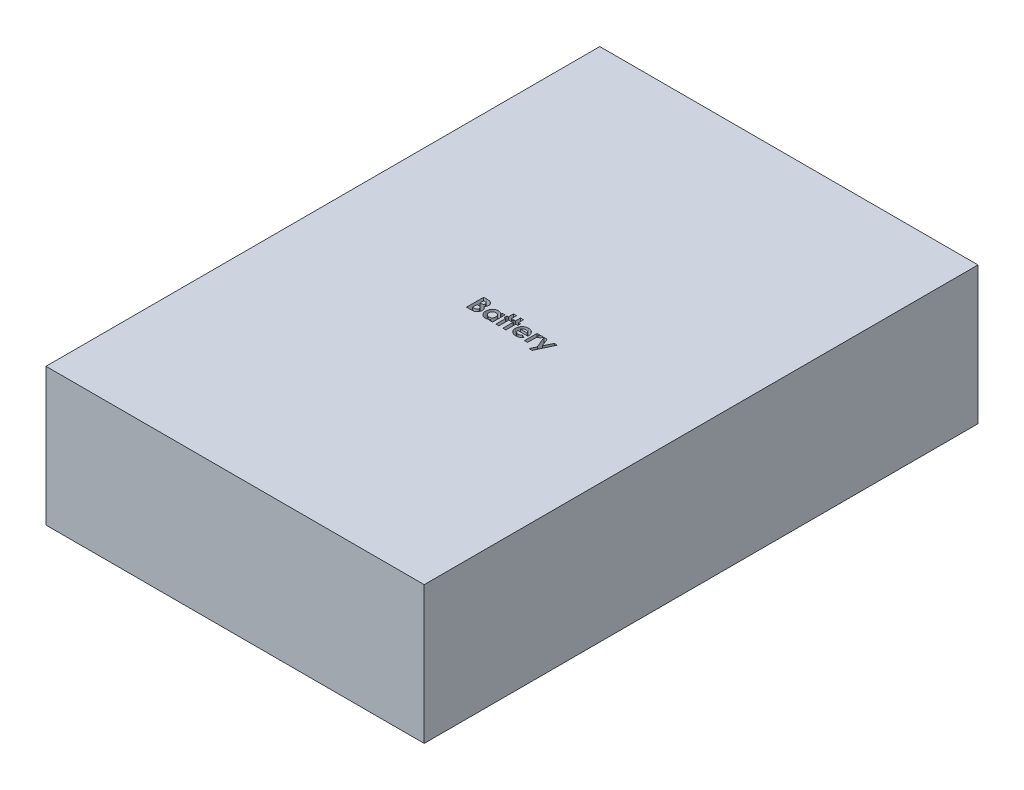
from build123d import *

# Parameters (mm, degrees)
SKETCH1_W           = 279.4
SKETCH1_H           = 409.1
BOSS_EXTRUDE1_DEPTH = 101.6
CUT_EXTRUDE1_DEPTH  = 101.6


with BuildPart() as part:
    # Sketch1 → Boss-Extrude1 (new body)
    with BuildSketch(Plane(origin=(0, 0, 0), x_dir=(1, 0, 0), z_dir=(0, 1, 0))):
        with Locations((139.7, 204.55)):
            Rectangle(SKETCH1_W, SKETCH1_H)
    extrude(amount=BOSS_EXTRUDE1_DEPTH)

    # Sketch2 → Cut-Extrude1 (cut)
    # profile 1 of 7: a face of its own
    with BuildSketch(Plane(origin=(0, 101.6, 0), x_dir=(1, 0, 0), z_dir=(0, 1, 0))):
        with BuildLine():
            Line((117.496663444, 193.133578888), (117.496663444, 205.833578888))
            Line((117.496663444, 205.833578888), (119.531919854, 205.833578888))
            add(Edge.make_bspline(
                [(119.531919854, 205.833578888), (119.674400529, 205.833595149), (119.950097933, 205.833626612), (120.347857336, 205.819658608), (120.716745592, 205.80158943), (121.055588753, 205.781374221), (121.364963555, 205.746539377), (121.644399542, 205.709827257), (121.89445503, 205.665554702), (122.04905075, 205.62584085), (122.121783636, 205.607156612)],
                knots=[0, 0, 0, 0, 1.311965854, 2.538629056, 3.664479157, 4.713267157, 5.663616078, 6.530575999, 7.308677837, 8, 8, 8, 8], degree=3))
            add(Edge.make_bspline(
                [(122.121783636, 205.607156612), (122.217289299, 205.580802163), (122.404702071, 205.529086273), (122.673136967, 205.424643797), (122.927784911, 205.30854858), (123.168334985, 205.176105652), (123.393310114, 205.025716053), (123.601855317, 204.856186249), (123.798468398, 204.674321156), (123.976168075, 204.475052247), (124.136779304, 204.264487733), (124.276321667, 204.042682786), (124.397566095, 203.81302895), (124.494593395, 203.572636183), (124.567701643, 203.32261156), (124.62117271, 203.064022723), (124.655829203, 202.796051434), (124.659103787, 202.613741808), (124.660766008, 202.52119908)],
                knots=[0, 0, 0, 0, 1.099996261, 2.158545794, 3.195537121, 4.207578794, 5.205712374, 6.197378256, 7.190519799, 8.17788031, 9.159561366, 10.129234751, 11.085776129, 12.040971148, 13.00380137, 13.975669004, 14.972423361, 16, 16, 16, 16], degree=3))
            add(Edge.make_bspline(
                [(124.660766008, 202.52119908), (124.656419793, 202.402305966), (124.647864803, 202.168279478), (124.593214946, 201.824536907), (124.49073795, 201.499650771), (124.356649293, 201.18763354), (124.17433064, 200.889649041), (123.942821212, 200.605838956), (123.665870704, 200.327464349), (123.453434375, 200.160597549), (123.342937482, 200.073803247)],
                knots=[0, 0, 0, 0, 0.986156485, 1.941127874, 2.875419072, 3.804401753, 4.751181392, 5.761612777, 6.835722519, 8, 8, 8, 8], degree=3))
            add(Edge.make_bspline(
                [(123.342937482, 200.073803247), (123.432478863, 200.028093148), (123.608044739, 199.938468291), (123.857296704, 199.791151781), (124.088076815, 199.634461989), (124.301419821, 199.471551577), (124.492850608, 199.295514535), (124.670273675, 199.116494361), (124.824935888, 198.924233942), (124.9632395, 198.725585807), (125.083450752, 198.517673507), (125.188141497, 198.300848159), (125.276570013, 198.074369041), (125.351453568, 197.839388747), (125.407301744, 197.595099056), (125.443715942, 197.3414126), (125.471596928, 197.079194578), (125.473765806, 196.90057821), (125.474868572, 196.809760779)],
                knots=[0, 0, 0, 0, 1.164658916, 2.283573913, 3.35186032, 4.395461096, 5.390182219, 6.362969632, 7.312859996, 8.245001507, 9.165155236, 10.092416118, 11.032087915, 11.979892451, 12.947605196, 13.931445124, 14.948243989, 16, 16, 16, 16], degree=3))
            add(Edge.make_bspline(
                [(125.474868572, 196.809760779), (125.46771236, 196.636304679), (125.453589605, 196.293989761), (125.350330909, 195.791392844), (125.171313142, 195.314885381), (124.930929194, 194.866361217), (124.634729921, 194.45880439), (124.294185697, 194.101788147), (123.912725021, 193.799581824), (123.560781443, 193.595616), (123.256377963, 193.458735859), (123.004246248, 193.374107924), (122.733462131, 193.295708733), (122.439065496, 193.240655202), (122.126393353, 193.190264157), (121.79239713, 193.159151682), (121.437701059, 193.138067524), (121.194080464, 193.135105349), (121.068538444, 193.133578888)],
                knots=[0, 0, 0, 0, 1.284142165, 2.534249414, 3.780121997, 5.041676246, 6.291546858, 7.49970053, 8.684500223, 9.883330709, 10.50184324, 11.153274765, 11.851151195, 12.587658647, 13.369265475, 14.195992086, 15.070362669, 16, 16, 16, 16], degree=3))
            Line((121.068538444, 193.133578888), (117.496663444, 193.133578888))
        make_face()
        with BuildLine():
            Line((119.776150623, 203.554091709), (119.776150623, 200.786142991))
            Line((119.776150623, 200.786142991), (120.381639405, 200.786142991))
            add(Edge.make_bspline(
                [(120.381639405, 200.786142991), (120.463930771, 200.786860602), (120.622789272, 200.788245909), (120.852243526, 200.806088172), (121.065598927, 200.836528181), (121.262046263, 200.878999652), (121.443415514, 200.932932227), (121.608548039, 200.99782473), (121.756717782, 201.077000637), (121.928856753, 201.194936645), (122.110820059, 201.36848476), (122.271000311, 201.61921097), (122.365345409, 201.907545157), (122.375852909, 202.110900752), (122.381278828, 202.215910619)],
                knots=[0, 0, 0, 0, 1.065314748, 2.056525647, 2.977365736, 3.853934255, 4.656397591, 5.425096493, 6.14721249, 6.826394842, 8.123232004, 9.372140726, 10.643011755, 12, 12, 12, 12], degree=3))
            add(Edge.make_bspline(
                [(122.381278828, 202.215910619), (122.376937099, 202.314269806), (122.368542541, 202.504443342), (122.273549156, 202.771463924), (122.126005651, 203.008098807), (121.951809805, 203.170056034), (121.787770566, 203.280668044), (121.647310104, 203.353501343), (121.4931442, 203.418700968), (121.322288366, 203.46855419), (121.135718284, 203.505962292), (120.934340229, 203.533434064), (120.717806753, 203.55213252), (120.56824662, 203.553424638), (120.491034437, 203.554091709)],
                knots=[0, 0, 0, 0, 1.347982417, 2.606269829, 3.849316587, 5.153353503, 5.842674298, 6.568177932, 7.326619318, 8.142485038, 9.012069166, 9.942760135, 10.937925643, 12, 12, 12, 12], degree=3))
            Line((120.491034437, 203.554091709), (119.776150623, 203.554091709))
        make_face(mode=Mode.SUBTRACT)
        with BuildLine():
            Line((119.776150623, 198.669476324), (119.776150623, 195.413066067))
            Line((119.776150623, 195.413066067), (120.432520815, 195.413066067))
            add(Edge.make_bspline(
                [(120.432520815, 195.413066067), (120.562286038, 195.413807411), (120.811775872, 195.415232738), (121.169169616, 195.432454067), (121.494129878, 195.463492479), (121.785795635, 195.502241436), (122.04461363, 195.554740211), (122.269708995, 195.621485677), (122.464168621, 195.694917314), (122.626826519, 195.785614105), (122.759708704, 195.891162678), (122.879620943, 195.999035855), (122.977389911, 196.123477757), (123.054746543, 196.259146436), (123.121698571, 196.402671786), (123.162079307, 196.55965842), (123.192823782, 196.72545363), (123.194515732, 196.840130591), (123.195381392, 196.898803247)],
                knots=[0, 0, 0, 0, 1.753078804, 3.370512758, 4.83203934, 6.162291463, 7.344201807, 8.395507345, 9.331626367, 10.147333109, 10.898971645, 11.62040215, 12.321813352, 13.025280112, 13.727906689, 14.453419512, 15.208716525, 16, 16, 16, 16], degree=3))
            add(Edge.make_bspline(
                [(123.195381392, 196.898803247), (123.193472364, 196.965896352), (123.18975409, 197.09657567), (123.159386902, 197.287577441), (123.104199802, 197.465890267), (123.034688957, 197.636073848), (122.937960923, 197.792035018), (122.82300296, 197.939171003), (122.684104393, 198.072499324), (122.527904852, 198.200084175), (122.345713552, 198.311791625), (122.137445014, 198.408717625), (121.901967811, 198.48966665), (121.638552526, 198.554118317), (121.348353951, 198.608817556), (121.029253957, 198.64147904), (120.683910118, 198.665770821), (120.44444308, 198.66821309), (120.320581713, 198.669476324)],
                knots=[0, 0, 0, 0, 0.845221588, 1.646264278, 2.427170338, 3.19324141, 3.95557735, 4.731569926, 5.540061037, 6.376114724, 7.268642756, 8.224665384, 9.265483498, 10.400594375, 11.639216012, 12.983232105, 14.439614077, 16, 16, 16, 16], degree=3))
            Line((120.320581713, 198.669476324), (119.776150623, 198.669476324))
        make_face(mode=Mode.SUBTRACT)
    # profile 2 of 7: a face of its own
    with BuildSketch(Plane(origin=(0, 101.6, 0), x_dir=(1, 0, 0), z_dir=(0, 1, 0))):
        with BuildLine():
            Line((134.429996777, 202.414348119), (136.709483956, 202.414348119))
            Line((136.709483956, 202.414348119), (136.709483956, 193.133578888))
            Line((136.709483956, 193.133578888), (134.429996777, 193.133578888))
            Line((134.429996777, 193.133578888), (134.429996777, 194.146118952))
            add(Edge.make_bspline(
                [(134.429996777, 194.146118952), (134.317049027, 194.047559383), (134.097839749, 193.856274724), (133.75243686, 193.608078015), (133.406024663, 193.403347807), (133.05693864, 193.240291361), (132.699813483, 193.119890959), (132.332078035, 193.032718256), (131.948436514, 192.98131038), (131.687642294, 192.974312348), (131.555197097, 192.970758375)],
                knots=[0, 0, 0, 0, 1.129196829, 2.191548051, 3.199897424, 4.157751732, 5.089409408, 6.034969131, 7.002052659, 8, 8, 8, 8], degree=3))
            add(Edge.make_bspline(
                [(131.555197097, 192.970758375), (131.406521477, 192.974103112), (131.112730025, 192.9807125), (130.681623686, 193.050286981), (130.265347656, 193.156786231), (129.864239836, 193.307495981), (129.479030005, 193.502786272), (129.10677014, 193.737561706), (128.753841909, 194.020064306), (128.417307305, 194.338070904), (128.10917824, 194.687880424), (127.839808903, 195.064637559), (127.612750572, 195.462998839), (127.42673383, 195.881643515), (127.280407641, 196.320264324), (127.176098007, 196.780252439), (127.114555203, 197.261772143), (127.106937938, 197.589764508), (127.1030737, 197.75615501)],
                knots=[0, 0, 0, 0, 0.980476535, 1.937477201, 2.874147792, 3.812856188, 4.758993464, 5.720109578, 6.712210464, 7.737600662, 8.772720504, 9.783789959, 10.789002326, 11.793715968, 12.802552247, 13.835794126, 14.902098527, 16, 16, 16, 16], degree=3))
            add(Edge.make_bspline(
                [(127.1030737, 197.75615501), (127.107129232, 197.928452593), (127.115084611, 198.2664335), (127.173277727, 198.762404411), (127.275662456, 199.233797893), (127.415271394, 199.681266894), (127.59485405, 200.104888719), (127.813573727, 200.505357396), (128.074405899, 200.881626165), (128.374968739, 201.227290666), (128.699502785, 201.544108877), (129.046696841, 201.819924254), (129.411121551, 202.054242252), (129.793164183, 202.245536668), (130.192770176, 202.393359312), (130.608361893, 202.501429736), (131.041784268, 202.566275786), (131.337035103, 202.573507529), (131.486507194, 202.577168632)],
                knots=[0, 0, 0, 0, 1.136281865, 2.228943489, 3.287578264, 4.313574083, 5.316051562, 6.317280042, 7.318008486, 8.329309503, 9.333984563, 10.305318864, 11.248632312, 12.186624717, 13.117503092, 14.05354244, 15.014596925, 16, 16, 16, 16], degree=3))
            add(Edge.make_bspline(
                [(131.486507194, 202.577168632), (131.624966781, 202.574292105), (131.898928398, 202.568600495), (132.301612501, 202.506800503), (132.692158002, 202.413332405), (133.068434456, 202.280157189), (133.433528207, 202.111996386), (133.781159412, 201.901278365), (134.118932818, 201.656859511), (134.325027704, 201.465963208), (134.429996777, 201.368735138)],
                knots=[0, 0, 0, 0, 1.017011718, 2.012299608, 2.98747302, 3.965332399, 4.941441765, 5.936729654, 6.94912688, 8, 8, 8, 8], degree=3))
            Line((134.429996777, 201.368735138), (134.429996777, 202.414348119))
        make_face()
        with BuildLine():
            add(Edge.make_bspline(
                [(131.96479245, 200.460501965), (131.873961605, 200.457714961), (131.695939081, 200.452252616), (131.434132596, 200.419396226), (131.183924134, 200.361501803), (130.947098164, 200.275975226), (130.720125109, 200.171791395), (130.506451588, 200.04130286), (130.304314091, 199.887068184), (130.114901408, 199.712821388), (129.94222384, 199.5212923), (129.793365699, 199.312292568), (129.666860327, 199.091453547), (129.559869661, 198.858111249), (129.483288619, 198.609504514), (129.422636464, 198.348869761), (129.391161923, 198.074077735), (129.385456581, 197.886815474), (129.38256088, 197.791771997)],
                knots=[0, 0, 0, 0, 1.04836806, 2.054732945, 3.03993516, 4.00574415, 4.955904794, 5.917688631, 6.888591924, 7.88601754, 8.884115178, 9.859153345, 10.841239365, 11.818093293, 12.814750328, 13.83810466, 14.90274714, 16, 16, 16, 16], degree=3))
            add(Edge.make_bspline(
                [(129.38256088, 197.791771997), (129.385412348, 197.69586642), (129.391031134, 197.506885593), (129.423145377, 197.229775598), (129.481615016, 196.965333583), (129.566920015, 196.715697381), (129.671097206, 196.477498575), (129.797904276, 196.251836473), (129.95366455, 196.042701065), (130.126493489, 195.845143505), (130.319791942, 195.66873227), (130.523073216, 195.512095291), (130.739113969, 195.38103723), (130.965570315, 195.275115277), (131.201679989, 195.188797788), (131.450403092, 195.13163098), (131.709303066, 195.095085321), (131.885802016, 195.0899961), (131.974968732, 195.087425042)],
                knots=[0, 0, 0, 0, 1.099136573, 2.165835871, 3.191374663, 4.196217796, 5.183857741, 6.167377911, 7.154730987, 8.166690795, 9.170734848, 10.148332609, 11.103258353, 12.059567475, 13.009337315, 13.978056681, 14.978520572, 16, 16, 16, 16], degree=3))
            add(Edge.make_bspline(
                [(131.974968732, 195.087425042), (132.067491407, 195.09022767), (132.248886148, 195.095722345), (132.514963873, 195.128278885), (132.768533531, 195.186385583), (133.008540136, 195.272401819), (133.238649561, 195.375837817), (133.456785274, 195.503776506), (133.660580174, 195.657657255), (133.851066388, 195.833479248), (134.025610284, 196.026572286), (134.176527016, 196.238312717), (134.307981011, 196.461928503), (134.41136353, 196.702706734), (134.493463748, 196.956434916), (134.552368761, 197.224687741), (134.584409672, 197.507754416), (134.589979317, 197.700958452), (134.59281729, 197.799404209)],
                knots=[0, 0, 0, 0, 1.050008698, 2.058587853, 3.036635738, 3.995319155, 4.947022481, 5.895997462, 6.858296291, 7.838991643, 8.833936038, 9.806048392, 10.784806122, 11.771666913, 12.772873988, 13.80724452, 14.882696879, 16, 16, 16, 16], degree=3))
            add(Edge.make_bspline(
                [(134.59281729, 197.799404209), (134.590014581, 197.896156745), (134.584540077, 198.085142554), (134.552230577, 198.36229893), (134.492907372, 198.625284494), (134.412496912, 198.874582647), (134.307275186, 199.109623371), (134.175721729, 199.327800625), (134.026460467, 199.536673433), (133.849984118, 199.724549959), (133.660529811, 199.899098865), (133.453737776, 200.048326148), (133.236123087, 200.176934362), (133.006348715, 200.282526665), (132.762287051, 200.359929826), (132.50828406, 200.419860262), (132.240376766, 200.452232896), (132.058152963, 200.457700628), (131.96479245, 200.460501965)],
                knots=[0, 0, 0, 0, 1.106611376, 2.161533483, 3.185006901, 4.184773755, 5.152708835, 6.122342771, 7.094156588, 8.082475533, 9.064254463, 10.03606828, 10.992420271, 11.951521816, 12.920622147, 13.915721683, 14.932141191, 16, 16, 16, 16], degree=3))
        make_face(mode=Mode.SUBTRACT)
    # profile 3 of 7: a face of its own
    with BuildSketch(Plane(origin=(0, 101.6, 0), x_dir=(1, 0, 0), z_dir=(0, 1, 0))):
        Polygon((139.151791649, 206.159219914), (141.431278828, 206.159219914), (141.431278828, 202.414348119), (142.896663444, 202.414348119), (142.896663444, 200.460501965), (141.431278828, 200.460501965), (141.431278828, 193.133578888), (139.151791649, 193.133578888), (139.151791649, 200.460501965), (138.012048059, 200.460501965), (138.012048059, 202.414348119), (139.151791649, 202.414348119), align=None)
    # profile 4 of 7: a face of its own
    with BuildSketch(Plane(origin=(0, 101.6, 0), x_dir=(1, 0, 0), z_dir=(0, 1, 0))):
        Polygon((144.362048059, 206.159219914), (146.641535239, 206.159219914), (146.641535239, 202.414348119), (148.106919854, 202.414348119), (148.106919854, 200.460501965), (146.641535239, 200.460501965), (146.641535239, 193.133578888), (144.362048059, 193.133578888), (144.362048059, 200.460501965), (143.222304469, 200.460501965), (143.222304469, 202.414348119), (144.362048059, 202.414348119), align=None)
    # profile 5 of 7: a face of its own
    with BuildSketch(Plane(origin=(0, 101.6, 0), x_dir=(1, 0, 0), z_dir=(0, 1, 0))):
        with BuildLine():
            Line((158.682620976, 197.204091709), (151.36333011, 197.204091709))
            add(Edge.make_bspline(
                [(151.36333011, 197.204091709), (151.378253553, 197.119045701), (151.407579296, 196.951923587), (151.47126119, 196.709164214), (151.552528837, 196.480391878), (151.649922994, 196.265300767), (151.761801596, 196.06275378), (151.892298717, 195.873700938), (152.039759119, 195.698309228), (152.203330225, 195.53734092), (152.380285603, 195.393109828), (152.569767084, 195.266754273), (152.771970201, 195.163150447), (152.984576771, 195.075823173), (153.209175455, 195.006651125), (153.446096806, 194.958944479), (153.69471278, 194.930763989), (153.864077577, 194.926688003), (153.950649822, 194.924604529)],
                knots=[0, 0, 0, 0, 1.091296461, 2.144483647, 3.168565212, 4.157007626, 5.126487748, 6.090021542, 7.05641414, 8.019231907, 8.98705074, 9.938580405, 10.892824166, 11.854447369, 12.841318655, 13.858982407, 14.905600794, 16, 16, 16, 16], degree=3))
            add(Edge.make_bspline(
                [(153.950649822, 194.924604529), (154.055148398, 194.927363392), (154.260936869, 194.932796407), (154.562418512, 194.980979175), (154.853995176, 195.05375713), (155.13290752, 195.161984057), (155.402386304, 195.296707556), (155.657995081, 195.464556458), (155.904158238, 195.660625671), (156.054346773, 195.811755745), (156.130918251, 195.888807253)],
                knots=[0, 0, 0, 0, 1.021034703, 2.010718019, 2.977989445, 3.954245119, 4.929443971, 5.918328161, 6.938689359, 8, 8, 8, 8], degree=3))
            Line((156.130918251, 195.888807253), (158.038971136, 194.98057408))
            add(Edge.make_bspline(
                [(158.038971136, 194.98057408), (157.978897204, 194.897561127), (157.859862919, 194.733074013), (157.665543441, 194.501598161), (157.462758693, 194.285621801), (157.251357438, 194.086565442), (157.031071566, 193.904996315), (156.802513859, 193.738702582), (156.562344039, 193.592149161), (156.315364259, 193.458245888), (156.05646899, 193.343451232), (155.78637471, 193.245558402), (155.506225418, 193.157064117), (155.212483435, 193.089636319), (154.907594748, 193.036261024), (154.590830003, 192.998357494), (154.262230949, 192.974946299), (154.038884086, 192.972170931), (153.925209117, 192.970758375)],
                knots=[0, 0, 0, 0, 1.028154879, 2.037251081, 3.030720504, 4.000128189, 4.949298328, 5.894184978, 6.834267904, 7.770992897, 8.712077017, 9.673380525, 10.653304757, 11.658697181, 12.695551717, 13.758623199, 14.859225354, 16, 16, 16, 16], degree=3))
            add(Edge.make_bspline(
                [(153.925209117, 192.970758375), (153.750322043, 192.974323796), (153.40781579, 192.981306469), (152.906838479, 193.046115659), (152.431048985, 193.153576282), (151.979103843, 193.299652494), (151.552956663, 193.492518857), (151.152396543, 193.728410418), (150.773421314, 194.002804662), (150.427610786, 194.321460397), (150.112567192, 194.66829822), (149.835852487, 195.040778357), (149.604301563, 195.43629843), (149.414147287, 195.852240806), (149.266352778, 196.289670133), (149.159801509, 196.748777297), (149.094484305, 197.229343019), (149.087429723, 197.556661921), (149.083842931, 197.723082093)],
                knots=[0, 0, 0, 0, 1.103565453, 2.161269334, 3.182010356, 4.179077853, 5.15417608, 6.128274628, 7.109042802, 8.101804412, 9.090965879, 10.063106201, 11.02526161, 11.978650795, 12.945248442, 13.93468508, 14.949922959, 16, 16, 16, 16], degree=3))
            add(Edge.make_bspline(
                [(149.083842931, 197.723082093), (149.087465024, 197.893731215), (149.094591331, 198.229475699), (149.159239129, 198.721137903), (149.266647355, 199.190250147), (149.414874196, 199.637458446), (149.602143808, 200.064161477), (149.836640821, 200.4666261), (150.112429874, 200.846253476), (150.426338529, 201.201267672), (150.773614018, 201.52170677), (151.142627034, 201.807282043), (151.537523818, 202.045242316), (151.953837746, 202.23751407), (152.388905924, 202.393730016), (152.847757133, 202.497678681), (153.326900214, 202.567473988), (153.654431874, 202.5739017), (153.820902226, 202.577168632)],
                knots=[0, 0, 0, 0, 1.079208495, 2.12329425, 3.130605359, 4.119693003, 5.099659317, 6.073216462, 7.060498243, 8.06384408, 9.066070512, 10.045757761, 11.010926815, 11.975797609, 12.942977511, 13.929384301, 14.947594487, 16, 16, 16, 16], degree=3))
            add(Edge.make_bspline(
                [(153.820902226, 202.577168632), (153.996627127, 202.573547895), (154.34164486, 202.566438953), (154.846111324, 202.502155999), (155.325060003, 202.394040094), (155.780531487, 202.249226976), (156.206709219, 202.051488606), (156.612957615, 201.821401962), (156.989532536, 201.541076477), (157.340447868, 201.223980142), (157.657220673, 200.872172746), (157.934115203, 200.490002164), (158.169718369, 200.081198155), (158.360677073, 199.644102932), (158.508319824, 199.180028698), (158.614969725, 198.689578145), (158.679788715, 198.170885833), (158.686712027, 197.81570748), (158.690253187, 197.634039625)],
                knots=[0, 0, 0, 0, 1.080001299, 2.120471247, 3.119684163, 4.095710327, 5.052285597, 6.002875087, 6.961153713, 7.931888285, 8.906493152, 9.865905668, 10.82813294, 11.801621613, 12.7925306, 13.817193356, 14.883530496, 16, 16, 16, 16], degree=3))
            Line((158.690253187, 197.634039625), (158.682620976, 197.204091709))
        make_face()
        with BuildLine():
            add(Edge.make_bspline(
                [(156.410766008, 198.99511735), (156.367750691, 199.111198266), (156.282225034, 199.341997368), (156.089026136, 199.660443812), (155.83265738, 199.936231366), (155.534482125, 200.180388274), (155.193798226, 200.378561272), (154.821341228, 200.522044959), (154.421818917, 200.608079577), (154.146969096, 200.618169927), (154.006619373, 200.623322478)],
                knots=[0, 0, 0, 0, 0.954238005, 1.897273737, 2.851915805, 3.847685534, 4.862635127, 5.880135777, 6.917509367, 8, 8, 8, 8], degree=3))
            add(Edge.make_bspline(
                [(154.006619373, 200.623322478), (153.853334624, 200.618372825), (153.553694858, 200.608697285), (153.121484896, 200.505794363), (152.713792053, 200.352214825), (152.47343946, 200.193871061), (152.35297354, 200.114508375)],
                knots=[0, 0, 0, 0, 1.044195649, 2.041185066, 3.018232172, 4, 4, 4, 4], degree=3))
            add(Edge.make_bspline(
                [(152.35297354, 200.114508375), (152.277811803, 200.054064016), (152.117570822, 199.925199731), (151.909465398, 199.668127717), (151.704479824, 199.356871217), (151.587934223, 199.120449916), (151.526150623, 198.99511735)],
                knots=[0, 0, 0, 0, 0.82159062, 1.751589201, 2.808063854, 4, 4, 4, 4], degree=3))
            Line((151.526150623, 198.99511735), (156.410766008, 198.99511735))
        make_face(mode=Mode.SUBTRACT)
    # profile 6 of 7: a face of its own
    with BuildSketch(Plane(origin=(0, 101.6, 0), x_dir=(1, 0, 0), z_dir=(0, 1, 0))):
        with BuildLine():
            Line((160.318458315, 202.414348119), (162.272304469, 202.414348119))
            Line((162.272304469, 202.414348119), (162.272304469, 201.272060459))
            add(Edge.make_bspline(
                [(162.272304469, 201.272060459), (162.327575026, 201.373575877), (162.435603622, 201.571991974), (162.634061214, 201.838326292), (162.862057333, 202.062625624), (163.111399374, 202.249581394), (163.382843045, 202.395295059), (163.669119566, 202.499134415), (163.967779848, 202.566615608), (164.171515767, 202.573625628), (164.274487963, 202.577168632)],
                knots=[0, 0, 0, 0, 1.09866127, 2.147379032, 3.14564304, 4.131443017, 5.102343063, 6.064490016, 7.021754664, 8, 8, 8, 8], degree=3))
            add(Edge.make_bspline(
                [(164.274487963, 202.577168632), (164.349258626, 202.573667404), (164.501518395, 202.566537653), (164.733583708, 202.525092306), (164.968997316, 202.450151237), (165.123919757, 202.382676765), (165.2030737, 202.348202285)],
                knots=[0, 0, 0, 0, 0.931404136, 1.896671404, 2.925354185, 4, 4, 4, 4], degree=3))
            Line((165.2030737, 202.348202285), (164.495822097, 200.417252766))
            add(Edge.make_bspline(
                [(164.495822097, 200.417252766), (164.432603904, 200.447796741), (164.313778036, 200.505207655), (164.141263507, 200.572958449), (163.98469942, 200.614296671), (163.885440662, 200.620464697), (163.839451905, 200.623322478)],
                knots=[0, 0, 0, 0, 1.214386998, 2.282580073, 3.20428172, 4, 4, 4, 4], degree=3))
            add(Edge.make_bspline(
                [(163.839451905, 200.623322478), (163.796029575, 200.621428761), (163.71061037, 200.617703494), (163.584534014, 200.585779219), (163.46579634, 200.530726796), (163.348675387, 200.46019918), (163.242410699, 200.362160518), (163.136211648, 200.248663359), (163.042623359, 200.10853602), (162.943860571, 199.952567176), (162.859767589, 199.761661451), (162.787660446, 199.533759356), (162.723412403, 199.266223908), (162.679200978, 198.957634623), (162.63646886, 198.610977637), (162.611033655, 198.22370853), (162.592076474, 197.797051884), (162.590917369, 197.499230147), (162.590313283, 197.344015587)],
                knots=[0, 0, 0, 0, 0.544232178, 1.070598461, 1.618251235, 2.182094276, 2.777567932, 3.425210017, 4.127676488, 4.886675562, 5.738955394, 6.734782583, 7.883056018, 9.186093582, 10.642914445, 12.264202625, 14.053029461, 16, 16, 16, 16], degree=3))
            Line((162.590313283, 197.344015587), (162.597945495, 196.891171035))
            Line((162.597945495, 196.891171035), (162.597945495, 193.133578888))
            Line((162.597945495, 193.133578888), (160.318458315, 193.133578888))
            Line((160.318458315, 193.133578888), (160.318458315, 202.414348119))
        make_face()
    # profile 7 of 7: a face of its own
    with BuildSketch(Plane(origin=(0, 101.6, 0), x_dir=(1, 0, 0), z_dir=(0, 1, 0))):
        Polygon((165.442216328, 202.414348119), (167.724247578, 202.414348119), (170.258141809, 196.443414625), (173.061707514, 202.414348119), (175.379355751, 202.414348119), (169.413510399, 189.714348119), (167.095862162, 189.714348119), (169.057340527, 193.88916783), align=None)
    extrude(amount=-CUT_EXTRUDE1_DEPTH, mode=Mode.SUBTRACT)


with BuildPart() as cut_extrude1_piece_1:
    # of the separate pieces the step leaves, piece 1, a body of its own (cut_extrude1_pieces)
    add(part.part.solids().sort_by_distance((0, 0, 0))[0])


with BuildPart() as cut_extrude1_piece_2:
    # of the separate pieces the step leaves, piece 2, a body of its own (cut_extrude1_pieces)
    add(part.part.solids().sort_by_distance((134.59281729, 0, -197.799404209))[0])


with BuildPart() as cut_extrude1_piece_3:
    # of the separate pieces the step leaves, piece 3, a body of its own (cut_extrude1_pieces)
    add(part.part.solids().sort_by_distance((120.320581713, 0, -198.669476324))[0])


with BuildPart() as cut_extrude1_piece_4:
    # of the separate pieces the step leaves, piece 4, a body of its own (cut_extrude1_pieces)
    add(part.part.solids().sort_by_distance((120.491034437, 0, -203.554091709))[0])


with BuildPart() as cut_extrude1_piece_5:
    # of the separate pieces the step leaves, piece 5, a body of its own (cut_extrude1_pieces)
    add(part.part.solids().sort_by_distance((151.526150623, 0, -198.99511735))[0])


solid = Compound([cut_extrude1_piece_1.part, cut_extrude1_piece_2.part, cut_extrude1_piece_3.part, cut_extrude1_piece_4.part, cut_extrude1_piece_5.part])
